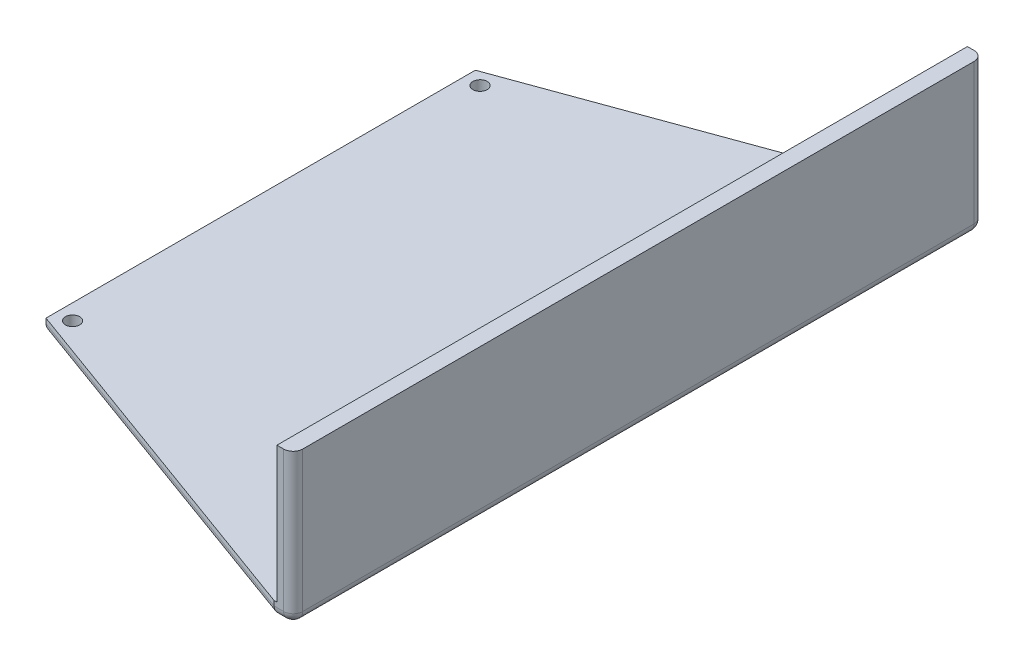
from build123d import *

# Parameters (mm, degrees)
BOSS_EXTRUDE1_DEPTH = 3
SKETCH2_W           = 3.4
SKETCH2_H           = 144.72
BOSS_EXTRUDE2_DEPTH = 31.5
SKETCH3_R           = 1.5
CUT_EXTRUDE1_DEPTH  = 40
FILLET1_R           = 2
FILLET2_R           = 2


with BuildPart() as part:
    # Sketch1 → Boss-Extrude1 (new body)
    with BuildSketch(Plane(origin=(0, 0, 0), x_dir=(1, 0, 0), z_dir=(0, 1, 0))):
        Polygon((-79.175996169, 45), (-79.175996169, -45), (-4, -72.36), (0, -72.36), (0, 72.36), (-4, 72.36), align=None)
    extrude(amount=BOSS_EXTRUDE1_DEPTH)

    # Sketch2 → Boss-Extrude2 (add)
    with BuildSketch(Plane.XZ):
        with Locations((-1.7, 0)):
            Rectangle(SKETCH2_W, SKETCH2_H)
    extrude(amount=-BOSS_EXTRUDE2_DEPTH)

    # Sketch3 → Cut-Extrude1 (cut)
    with BuildSketch(Plane(origin=(0, 3, 0), x_dir=(1, 0, 0), z_dir=(0, 1, 0))):
        with Locations(Location((-75.899387992, -42.705694255, 0), (0, 0, 270))):
            Circle(SKETCH3_R)
        with Locations(Location((-75.899387992, 42.705694255, 0), (0, 0, 270))):
            Circle(SKETCH3_R)
    extrude(amount=-CUT_EXTRUDE1_DEPTH, mode=Mode.SUBTRACT)

    # Fillet1
    # the kernel refuses this fillet: 2 mm, written as the material it takes off along each edge
    with BuildSketch(Plane(origin=(-9, 0, -72.36), x_dir=(0, 0, 1), z_dir=(1, 0, 0)), Plane(origin=(5, 0, 72.36), x_dir=(0, 0, -1), z_dir=(-1, 0, 0))) as fillet1_piece_1:
        with BuildLine():
            CenterArc((FILLET1_R, -FILLET1_R), FILLET1_R, 90, 90)
            Line((0, -FILLET1_R), (0, 0))
            Line((0, 0), (FILLET1_R, 0))
        make_face()
    extrude(amount=14, mode=Mode.SUBTRACT)
    with BuildSketch(Plane(origin=(0, 0, 77.36), x_dir=(-1, 0, 0), z_dir=(0, 0, -1))) as fillet1_piece_2:
        with BuildLine():
            CenterArc((FILLET1_R, FILLET1_R), FILLET1_R, 180, 90)
            Line((0, FILLET1_R), (0, 0))
            Line((0, 0), (FILLET1_R, 0))
        make_face()
    extrude(amount=154.72, mode=Mode.SUBTRACT)
    with BuildSketch(Plane(origin=(-83.87449593, 0, 43.29), x_dir=(0, 1, 0), z_dir=(0.9396999521123751, 0, 0.34199999999999997)), Plane(origin=(0.698499761, 0, -74.07), x_dir=(0, 1, 0), z_dir=(-0.9396999521123751, 0, 0.34199999999999997))) as fillet1_piece_3:
        with BuildLine():
            CenterArc((FILLET1_R, -FILLET1_R), FILLET1_R, 90, 90)
            Line((0, -FILLET1_R), (0, 0))
            Line((0, 0), (FILLET1_R, 0))
        make_face()
    extrude(amount=90, mode=Mode.SUBTRACT)
    with BuildSketch(Plane(origin=(-79.175996169, 0, -50), x_dir=(0, 1, 0), z_dir=(0, 0, 1))) as fillet1_piece_4:
        with BuildLine():
            CenterArc((FILLET1_R, -FILLET1_R), FILLET1_R, 90, 90)
            Line((0, -FILLET1_R), (0, 0))
            Line((0, 0), (FILLET1_R, 0))
        make_face()
    extrude(amount=100, mode=Mode.SUBTRACT)

    # Fillet2
    # the kernel refuses this fillet: 2 mm, written as the material it takes off along each edge
    with BuildSketch(Plane(origin=(-2, 2, -70.36), x_dir=(1, 0, 0), z_dir=(0, 0, -1))) as fillet2_piece_1_section:
        Polygon((0, 0), (FILLET2_R, 0), (FILLET2_R, FILLET2_R), (0, FILLET2_R), align=None)
    fillet2_piece_1 = extrude(amount=FILLET2_R, mode=Mode.PRIVATE)
    fillet2_piece_1 = fillet2_piece_1 - Plane(origin=(-2, 2, -70.36), x_dir=(-0.7071067811865475, 0.7071067811865475, 0), z_dir=(0, 0, -1)) * Sphere(FILLET2_R, mode=Mode.PRIVATE)
    add(fillet2_piece_1, mode=Mode.SUBTRACT)
    with BuildSketch(Plane(origin=(-2, 2, 70.36), x_dir=(1, 0, 0), z_dir=(0, 0, 1))) as fillet2_piece_2_section:
        Polygon((0, 0), (FILLET2_R, 0), (FILLET2_R, -FILLET2_R), (0, -FILLET2_R), align=None)
    fillet2_piece_2 = extrude(amount=FILLET2_R, mode=Mode.PRIVATE)
    fillet2_piece_2 = fillet2_piece_2 - Plane(origin=(-2, 2, 70.36), x_dir=(-0.7071067811865475, 0.7071067811865475, 0), z_dir=(0, 0, 1)) * Sphere(FILLET2_R, mode=Mode.PRIVATE)
    add(fillet2_piece_2, mode=Mode.SUBTRACT)
    with BuildSketch(Plane(origin=(0, 36.5, -72.36), x_dir=(-1, 0, 0), z_dir=(0, -1, 0)), Plane(origin=(0, 2, 72.36), x_dir=(-1, 0, 0), z_dir=(0, 1, 0))) as fillet2_piece_3:
        with BuildLine():
            CenterArc((FILLET2_R, -FILLET2_R), FILLET2_R, 90, 90)
            Line((0, -FILLET2_R), (0, 0))
            Line((0, 0), (FILLET2_R, 0))
        make_face()
    extrude(amount=34.5, mode=Mode.SUBTRACT)


solid = part.part
